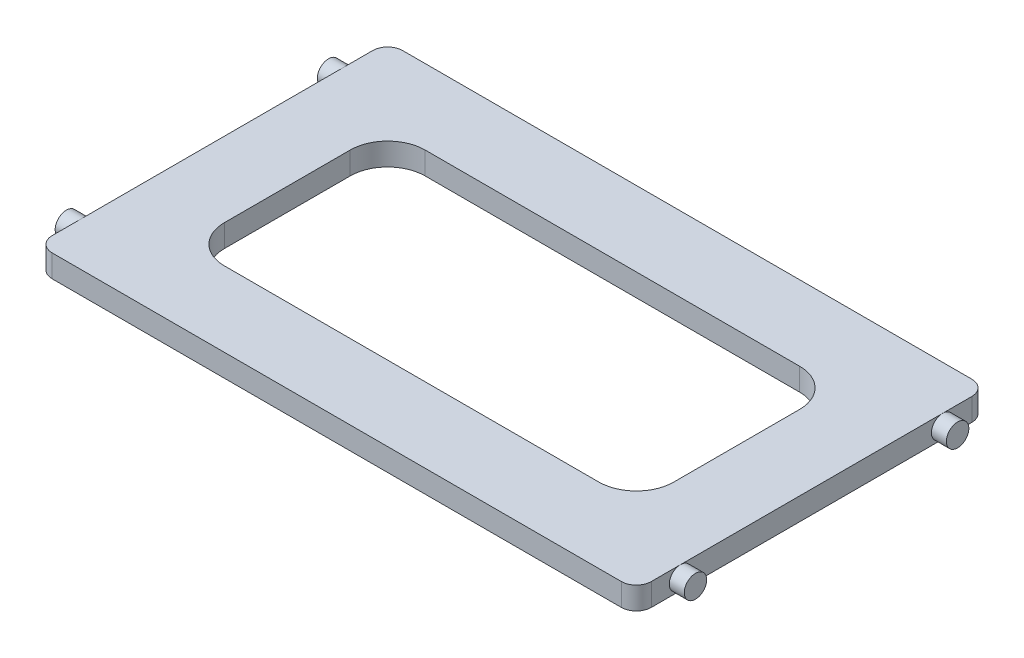
from build123d import *

# Parameters (mm, degrees)
SKETCH1_W                  = 101.6
SKETCH1_H                  = 59.436
BASE_EXTRUDE_DEPTH         = 3.81
BASE_CORNER_FILLET_R       = 2.54
SKETCH3_R                  = 1.905
PEG_EXTRUDE_DEPTH          = 2.54
MATERIAL_REMOVAL_CUT_DEPTH = 120.96788652


with BuildPart() as part:
    # Sketch1 → Base Extrude (new body)
    with BuildSketch(Plane(origin=(0, 0, 0), x_dir=(1, 0, 0), z_dir=(0, 1, 0))):
        with Locations((50.8, 29.718)):
            Rectangle(SKETCH1_W, SKETCH1_H)
    extrude(amount=BASE_EXTRUDE_DEPTH)

    # Base Corner Fillet
    base_corner_fillet_edges = [part.edges().sort_by_distance(p)[0] for p in [
        (0, 1.905, 0),
        (0, 1.905, -59.436),
        (101.6, 1.905, -59.436),
        (101.6, 1.905, 0),
    ]]
    fillet(base_corner_fillet_edges, radius=BASE_CORNER_FILLET_R)

    # Sketch3 → Peg Extrude (add)
    with BuildSketch(Plane.ZY):
        with Locations((-7.493, 1.905)):
            Circle(SKETCH3_R)
        with Locations((-51.943, 1.905)):
            Circle(SKETCH3_R)
    peg_extrude = extrude(amount=PEG_EXTRUDE_DEPTH)

    # Peg Mirror: Peg Extrude across plane
    add(peg_extrude.mirror(Plane(origin=(50.8, 0, 0), x_dir=(0, 0, 1), z_dir=(1, 0, 0))))

    # Sketch4 → Material Removal Cut (cut, through all)
    with BuildSketch(Plane.XZ):
        with BuildLine():
            Line((19.05, -12.7), (82.55, -12.7))
            ThreePointArc((82.55, -12.7), (87.040128061, -14.559871939), (88.9, -19.05))
            Line((88.9, -19.05), (88.9, -40.386))
            ThreePointArc((88.9, -40.386), (87.040128061, -44.876128061), (82.55, -46.736))
            Line((82.55, -46.736), (19.05, -46.736))
            ThreePointArc((19.05, -46.736), (14.559871939, -44.876128061), (12.7, -40.386))
            Line((12.7, -40.386), (12.7, -19.05))
            ThreePointArc((12.7, -19.05), (14.559871939, -14.559871939), (19.05, -12.7))
        make_face()
    extrude(amount=-MATERIAL_REMOVAL_CUT_DEPTH, mode=Mode.SUBTRACT)


solid = part.part
